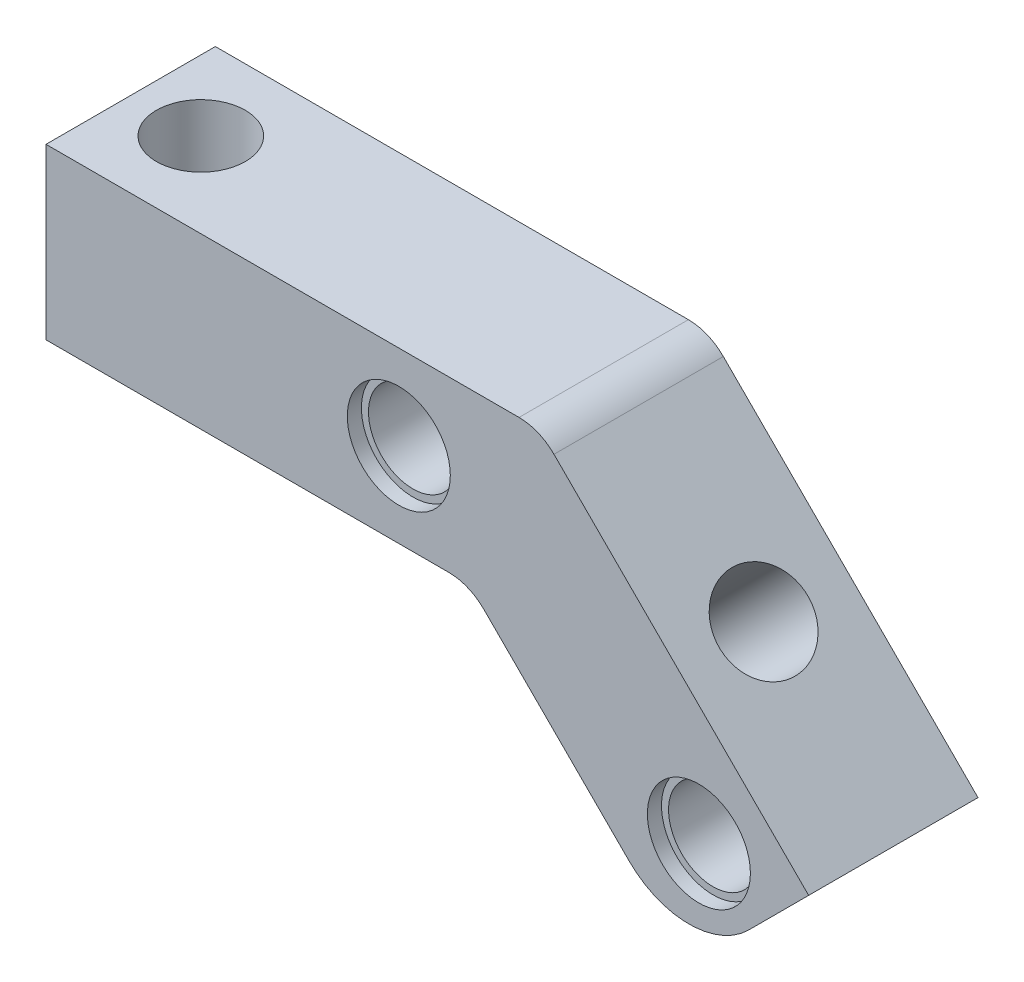
from build123d import *

# Parameters (mm, degrees)
BOSS_EXTRU_1_DEPTH           = 12
ENL_V_MAT_EXTRU_1_DEPTH      = 58.502155035
ENL_V_MAT_EXTRU_1_DEPTH_BACK = 58.502155035
ESQUISSE2_R                  = 3.15
ESQUISSE3_R                  = 3.15
ENL_V_MAT_EXTRU_2_DEPTH      = 12
ENL_V_MAT_EXTRU_3_DEPTH      = 62.837288217
ENL_V_MAT_EXTRU_3_DEPTH_BACK = 62.837288217
ESQUISSE4_R                  = 3.15
ESQUISSE5_R                  = 3.65
ENL_V_MAT_EXTRU_4_DEPTH      = 1
ENL_V_START                  = -1
ESQUISSE6_R                  = 3.65
ENL_V_MAT_EXTRU_5_DEPTH      = 1
ESQUISSE7_R                  = 3.65
ENL_V_MAT_EXTRU_6_DEPTH      = 1
ESQUISSE8_R                  = 3.65
ENL_V_MAT_EXTRU_7_DEPTH      = 1
CONG_1_R                     = 3.5
CONG_2_R                     = 6


with BuildPart() as part:
    # Esquisse1 → Boss.-Extru.1 (new body)
    with BuildSketch(Plane.XY):
        Polygon((0, 0), (30, 0), (45.556349186, -15.556349186), (54.04163056, -7.071067812), (34.970562748, 12), (0, 12), align=None)
    extrude(amount=BOSS_EXTRU_1_DEPTH)

    # Esquisse2 → Enlèv. mat.-Extru.1 (cut, two sides: drawn at the far end of the back side and taken through both)
    with BuildSketch(Plane.XY.offset(12).offset(-ENL_V_MAT_EXTRU_1_DEPTH_BACK)):
        with Locations((25, 6)):
            Circle(ESQUISSE2_R)
        with Locations((46.263455967, -7.778174593)):
            Circle(ESQUISSE2_R)
    extrude(amount=ENL_V_MAT_EXTRU_1_DEPTH + ENL_V_MAT_EXTRU_1_DEPTH_BACK, mode=Mode.SUBTRACT)

    # Esquisse3 → Enlèv. mat.-Extru.2 (cut)
    with BuildSketch(Plane(origin=(23.485281374, 23.485281374, 0), x_dir=(0, 0, -1), z_dir=(0.7071067811865485, 0.7071067811865467, 0))):
        with Locations((-6, -30.213203436)):
            Circle(ESQUISSE3_R)
    extrude(amount=-ENL_V_MAT_EXTRU_2_DEPTH, mode=Mode.SUBTRACT)

    # Esquisse4 → Enlèv. mat.-Extru.3 (cut, two sides: drawn at the far end of the back side and taken through both)
    with BuildSketch(Plane(origin=(0, 12, 0), x_dir=(1, 0, 0), z_dir=(0, 1, 0)).offset(-ENL_V_MAT_EXTRU_3_DEPTH_BACK)):
        with Locations((4.970562748, -6)):
            Circle(ESQUISSE4_R)
    extrude(amount=ENL_V_MAT_EXTRU_3_DEPTH + ENL_V_MAT_EXTRU_3_DEPTH_BACK, mode=Mode.SUBTRACT)

    # Esquisse5 → Enlèv. mat.-Extru.4 (cut)
    with BuildSketch(Plane.XY.offset(12)):
        with Locations((25, 6)):
            Circle(ESQUISSE5_R)
        with Locations((46.263455967, -7.778174593)):
            Circle(ESQUISSE5_R)
    extrude(amount=-ENL_V_MAT_EXTRU_4_DEPTH, mode=Mode.SUBTRACT)

    # Esquisse6 → Enlèv. mat.-Extru.5 (cut)
    with BuildSketch(Plane(origin=(0, 0, 0), x_dir=(-1, 0, 0), z_dir=(0, 0, -1)).offset(ENL_V_START)):
        with Locations((-25, 6)):
            Circle(ESQUISSE6_R)
        with Locations((-46.263455967, -7.778174593)):
            Circle(ESQUISSE6_R)
    extrude(amount=ENL_V_MAT_EXTRU_5_DEPTH, mode=Mode.SUBTRACT)

    # Esquisse7 → Enlèv. mat.-Extru.6 (cut)
    with BuildSketch(Plane(origin=(15, 15, 0), x_dir=(0, 0, 1), z_dir=(-0.7071067811865485, -0.7071067811865466, 0))):
        with Locations((6, -30.213203436)):
            Circle(ESQUISSE7_R)
    extrude(amount=-ENL_V_MAT_EXTRU_6_DEPTH, mode=Mode.SUBTRACT)

    # Esquisse8 → Enlèv. mat.-Extru.7 (cut)
    with BuildSketch(Plane.XZ):
        with Locations((4.970562748, 6)):
            Circle(ESQUISSE8_R)
    extrude(amount=-ENL_V_MAT_EXTRU_7_DEPTH, mode=Mode.SUBTRACT)

    # Congé1
    cong_1_edges = [part.edges().sort_by_distance(p)[0] for p in [
        (34.970562748, 12, 6),
        (30, 0, 6),
    ]]
    fillet(cong_1_edges, radius=CONG_1_R)

    # Congé2
    cong_2_edges = [part.edges().sort_by_distance(p)[0] for p in [
        (45.556349186, -15.556349186, 6),
    ]]
    fillet(cong_2_edges, radius=CONG_2_R)


solid = part.part
